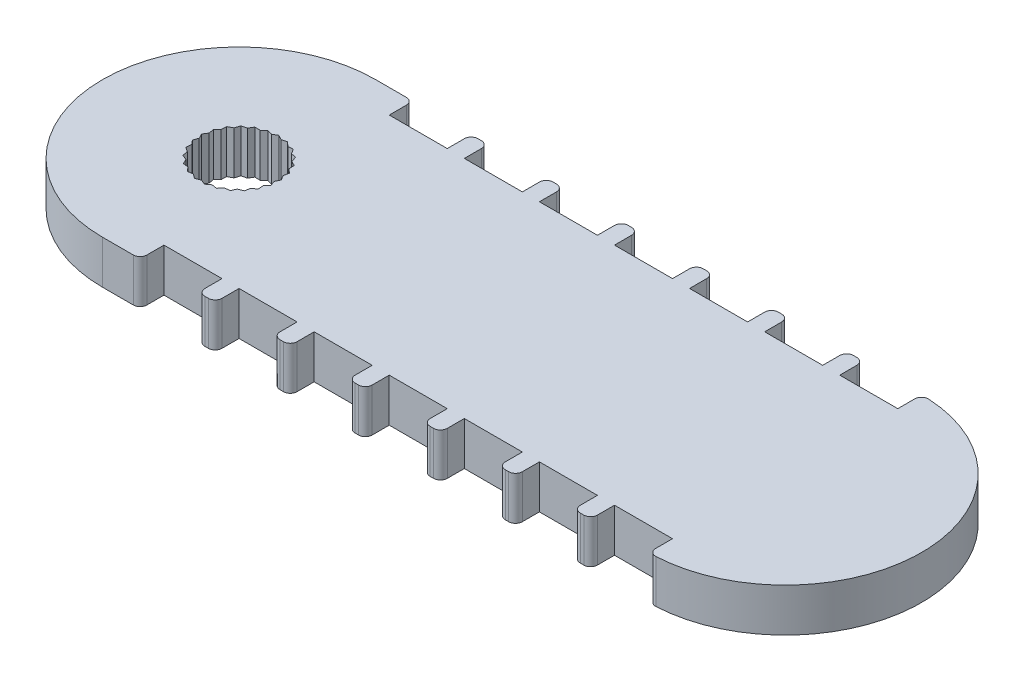
from build123d import *

# Parameters (mm, degrees)
BOSS_EXTRUDE1_DEPTH = 3.175
FILLET1_R           = 0.5


with BuildPart() as part:
    # Sketch1 → Boss-Extrude1 (new body)
    with BuildSketch(Plane(origin=(0, 0, 0), x_dir=(1, 0, 0), z_dir=(0, 1, 0))):
        with BuildLine():
            Line((0, 10), (2.75, 10))
            Line((2.75, 10), (2.75, 8.25))
            Line((2.75, 8.25), (7, 8.25))
            Line((7, 8.25), (7, 10))
            Line((7, 10), (8.25, 10))
            Line((8.25, 10), (8.25, 8.25))
            Line((8.25, 8.25), (12.5, 8.25))
            Line((12.5, 8.25), (12.5, 10))
            Line((12.5, 10), (13.75, 10))
            Line((13.75, 10), (13.75, 8.25))
            Line((13.75, 8.25), (18, 8.25))
            Line((18, 8.25), (18, 10))
            Line((18, 10), (19.25, 10))
            Line((19.25, 10), (19.25, 8.25))
            Line((19.25, 8.25), (23.5, 8.25))
            Line((23.5, 8.25), (23.5, 10))
            Line((23.5, 10), (24.75, 10))
            Line((24.75, 10), (24.75, 8.25))
            Line((24.75, 8.25), (29, 8.25))
            Line((29, 8.25), (29, 10))
            Line((29, 10), (30.25, 10))
            Line((30.25, 10), (30.25, 8.25))
            Line((30.25, 8.25), (34.5, 8.25))
            Line((34.5, 8.25), (34.5, 10))
            Line((34.5, 10), (35.75, 10))
            Line((35.75, 10), (35.75, 8.25))
            Line((35.75, 8.25), (40, 8.25))
            Line((40, 8.25), (40, 10))
            ThreePointArc((40, 10), (50, 0), (40, -10))
            Line((40, -10), (40, -8.25))
            Line((40, -8.25), (35.75, -8.25))
            Line((35.75, -8.25), (35.75, -10))
            Line((35.75, -10), (34.5, -10))
            Line((34.5, -10), (34.5, -8.25))
            Line((34.5, -8.25), (30.25, -8.25))
            Line((30.25, -8.25), (30.25, -10))
            Line((30.25, -10), (29, -10))
            Line((29, -10), (29, -8.25))
            Line((29, -8.25), (24.75, -8.25))
            Line((24.75, -8.25), (24.75, -10))
            Line((24.75, -10), (23.5, -10))
            Line((23.5, -10), (23.5, -8.25))
            Line((23.5, -8.25), (19.25, -8.25))
            Line((19.25, -8.25), (19.25, -10))
            Line((19.25, -10), (18, -10))
            Line((18, -10), (18, -8.25))
            Line((18, -8.25), (13.75, -8.25))
            Line((13.75, -8.25), (13.75, -10))
            Line((13.75, -10), (12.5, -10))
            Line((12.5, -10), (12.5, -8.25))
            Line((12.5, -8.25), (8.25, -8.25))
            Line((8.25, -8.25), (8.25, -10))
            Line((8.25, -10), (7, -10))
            Line((7, -10), (7, -8.25))
            Line((7, -8.25), (2.75, -8.25))
            Line((2.75, -8.25), (2.75, -10))
            Line((2.75, -10), (0, -10))
            ThreePointArc((0, -10), (-10, 0), (0, 10))
        make_face()
        Polygon((0, 2.925), (-0.344666392, 2.728315429), (-0.72741792, 2.833105746), (-1.01234252, 2.556885336), (-1.409129497, 2.563197039), (-1.616409444, 2.224796735), (-2.002300285, 2.132233235), (-2.118911418, 1.752915972), (-2.469659182, 1.567293375), (-2.488274394, 1.170893052), (-2.78184031, 0.903874709), (-2.70128994, 0.515298615), (-2.919228181, 0.18366227), (-2.744573503, -0.172673929), (-2.873190208, -0.548090345), (-2.61540542, -0.849796735), (-2.646619128, -1.245404428), (-2.321901795, -1.473523686), (-2.253751235, -1.86446517), (-1.882504541, -2.004663725), (-1.719271863, -2.366374709), (-1.324822604, -2.40984337), (-1.076764317, -2.719596221), (-0.68389719, -2.663603693), (-0.366599708, -2.901935501), (0, -2.75), (0.366599708, -2.901935501), (0.68389719, -2.663603693), (1.076764317, -2.719596221), (1.324822604, -2.40984337), (1.719271863, -2.366374709), (1.882504541, -2.004663725), (2.253751235, -1.86446517), (2.321901795, -1.473523686), (2.646619128, -1.245404428), (2.61540542, -0.849796735), (2.873190208, -0.548090345), (2.744573503, -0.172673929), (2.919228181, 0.18366227), (2.70128994, 0.515298615), (2.78184031, 0.903874709), (2.488274394, 1.170893052), (2.469659182, 1.567293375), (2.118911418, 1.752915972), (2.002300285, 2.132233235), (1.616409444, 2.224796735), (1.409129497, 2.563197039), (1.01234252, 2.556885336), (0.72741792, 2.833105746), (0.344666392, 2.728315429), align=None, mode=Mode.SUBTRACT)
    extrude(amount=BOSS_EXTRUDE1_DEPTH)

    # Fillet1
    fillet1_edges = [part.edges().sort_by_distance(p)[0] for p in [
        (8.25, 1.5875, -10),
        (7, 1.5875, -10),
        (2.75, 1.5875, -10),
        (2.75, 1.5875, 10),
        (7, 1.5875, 10),
        (8.25, 1.5875, 10),
        (12.5, 1.5875, 10),
        (13.75, 1.5875, 10),
        (18, 1.5875, 10),
        (19.25, 1.5875, 10),
        (23.5, 1.5875, 10),
        (24.75, 1.5875, 10),
        (29, 1.5875, 10),
        (30.25, 1.5875, 10),
        (34.5, 1.5875, 10),
        (35.75, 1.5875, 10),
        (40, 1.5875, 10),
        (40, 1.5875, -10),
        (35.75, 1.5875, -10),
        (34.5, 1.5875, -10),
        (30.25, 1.5875, -10),
        (29, 1.5875, -10),
        (24.75, 1.5875, -10),
        (23.5, 1.5875, -10),
        (19.25, 1.5875, -10),
        (18, 1.5875, -10),
        (13.75, 1.5875, -10),
        (12.5, 1.5875, -10),
    ]]
    fillet(fillet1_edges, radius=FILLET1_R)


solid = part.part
